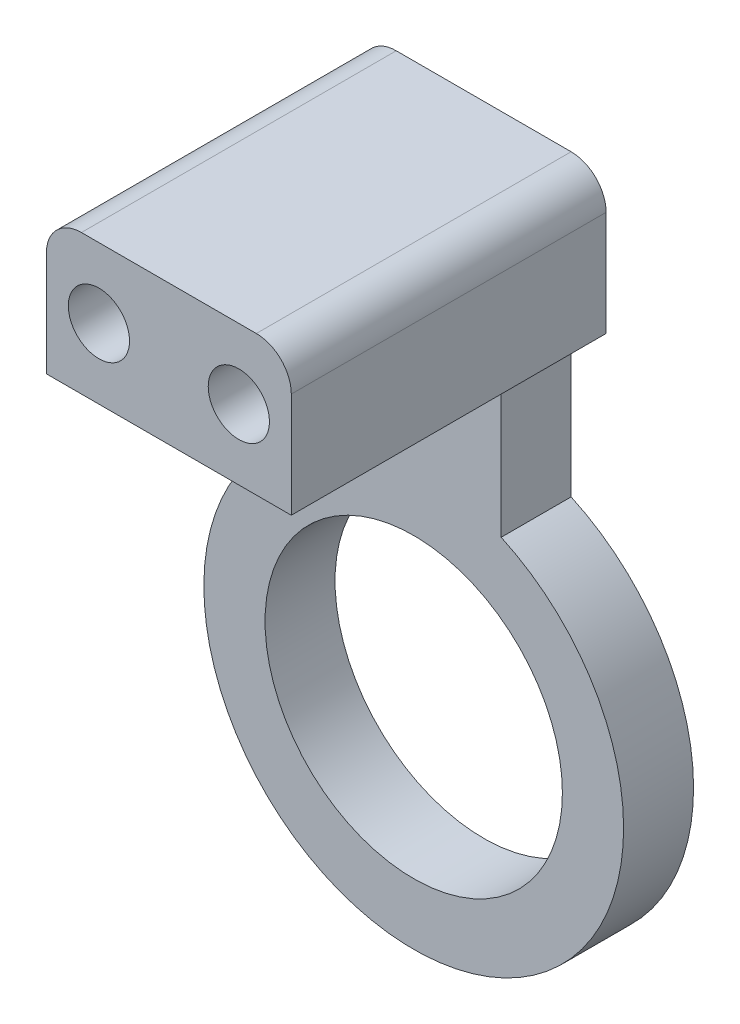
from build123d import *

# Parameters (mm, degrees)
SKETCH_1_W          = 14
SKETCH_1_H          = 8
EXTRUDE_1_DEPTH     = 18
SKETCH_1_3_R        = 8.5
EXTRUDE_2_DEPTH     = 4
FILLET_1_R          = 2
CUT_EXTRUDE_START   = -18
SKETCH_5_R          = 1.75
CUT_EXTRUDE_1_DEPTH = 18
FILLET_3_R          = 2


with BuildPart() as part:
    # 草图1 → 凸台-拉伸1 (new body)
    with BuildSketch(Plane.XY):
        Rectangle(SKETCH_1_W, SKETCH_1_H)
    extrude(amount=EXTRUDE_1_DEPTH)

    # 草图1<3> → 凸台-拉伸2 (add)
    with BuildSketch(Plane.XY):
        with BuildLine():
            Line((5, -13.091287885), (5, -4))
            Line((5, -4), (-5, -4))
            Line((-5, -4), (-5, -13.091287885))
            ThreePointArc((-5, -13.091287885), (0, -36), (5, -13.091287885))
        make_face()
        with Locations((0, -24)):
            Circle(SKETCH_1_3_R, mode=Mode.SUBTRACT)
    extrude(amount=EXTRUDE_2_DEPTH)

    # 圆角1
    fillet_1_edges = [part.edges().sort_by_distance(p)[0] for p in [
        (-5, -4, 2),
        (5, -4, 2),
    ]]
    fillet(fillet_1_edges, radius=FILLET_1_R - 0.0001)  # a hair under: the kernel refuses the full size

    # 草图5 → 切除-拉伸1 (cut)
    with BuildSketch(Plane(origin=(0, 0, 0), x_dir=(-1, 0, 0), z_dir=(0, 0, -1)).offset(CUT_EXTRUDE_START)):
        with Locations((-4, 0)):
            Circle(SKETCH_5_R)
        with Locations(Location((4, 0, 0), (0, 0, 180))):
            Circle(SKETCH_5_R)
    extrude(amount=CUT_EXTRUDE_1_DEPTH, mode=Mode.SUBTRACT)

    # 圆角3
    fillet_3_edges = [part.edges().sort_by_distance(p)[0] for p in [
        (-7, 4, 9),
        (7, 4, 9),
    ]]
    fillet(fillet_3_edges, radius=FILLET_3_R)


solid = part.part
